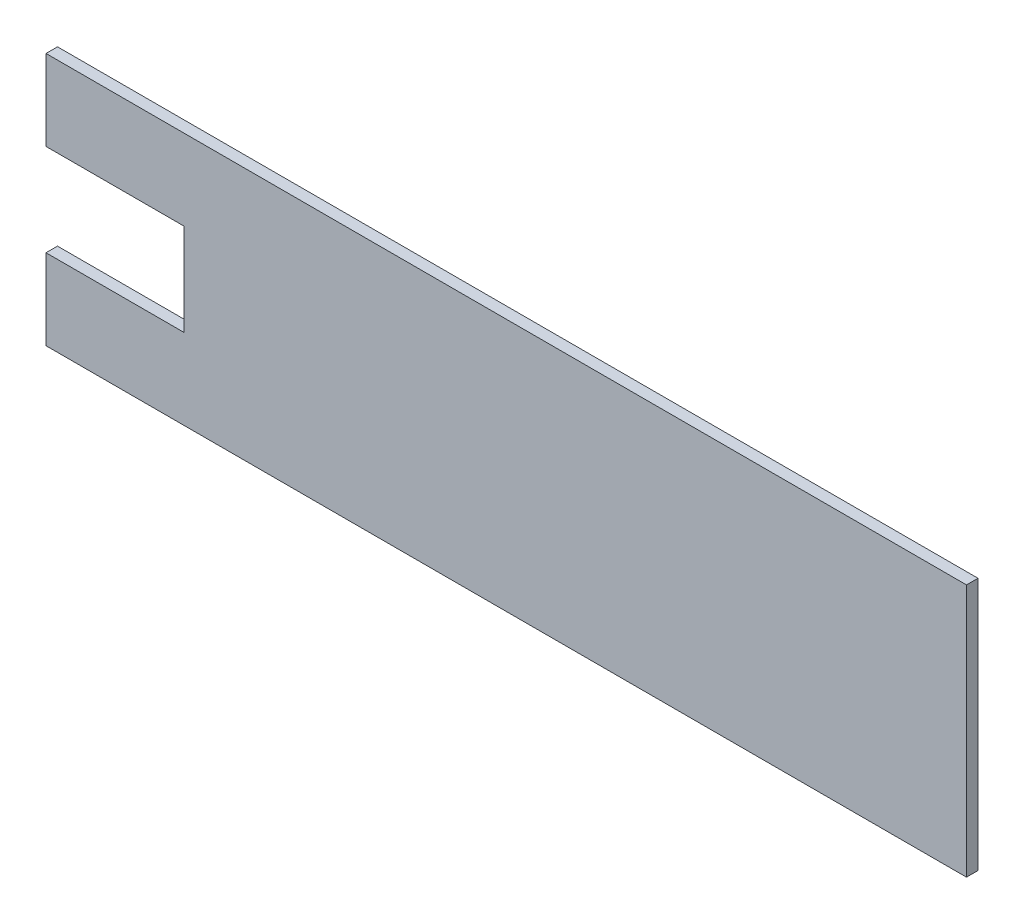
from build123d import *

# Parameters (mm, degrees)
SKETCH1_W           = 254
SKETCH1_H           = 69.85
BOSS_EXTRUDE1_DEPTH = 3.175
SKETCH2_W           = 38.1
SKETCH2_H           = 25.4
CUT_EXTRUDE1_DEPTH  = 264.448482867


with BuildPart() as part:
    # Sketch1 → Boss-Extrude1 (new body)
    with BuildSketch(Plane.XY):
        with Locations((127, 34.925)):
            Rectangle(SKETCH1_W, SKETCH1_H)
    extrude(amount=BOSS_EXTRUDE1_DEPTH)

    # Sketch2 → Cut-Extrude1 (cut, through all)
    with BuildSketch(Plane.XY.offset(3.175)):
        with Locations((19.05, 34.925)):
            Rectangle(SKETCH2_W, SKETCH2_H)
    extrude(amount=-CUT_EXTRUDE1_DEPTH, mode=Mode.SUBTRACT)


solid = part.part
